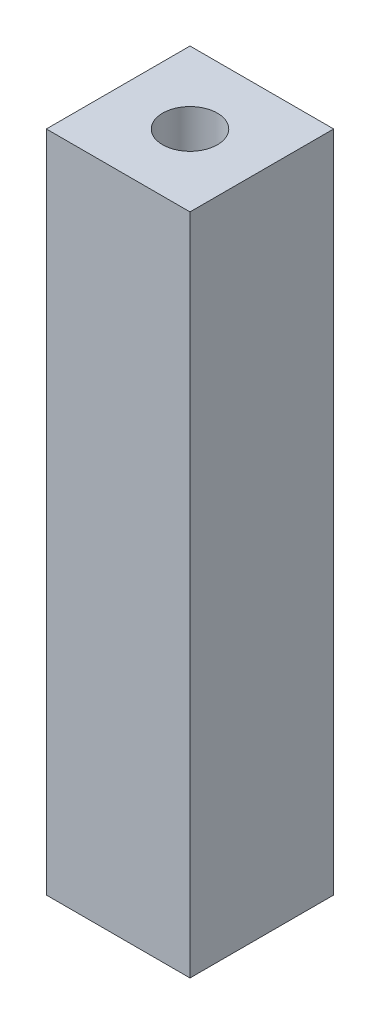
from build123d import *

# Parameters (mm, degrees)
SKETCH1_W             = 11
SKETCH1_H             = 11
BOSS_EXTRUDE1_DEPTH   = 50.8
M5X0_8_TAPPED_HOLE1_D = 4.2


with BuildPart() as part:
    # Sketch1 → Boss-Extrude1 (new body)
    with BuildSketch(Plane(origin=(0, 0, 0), x_dir=(1, 0, 0), z_dir=(0, 1, 0))):
        Rectangle(SKETCH1_W, SKETCH1_H)
    extrude(amount=BOSS_EXTRUDE1_DEPTH)

    # M5x0.8 Tapped Hole1 (through all)
    with Locations(Plane(origin=(0, 50.8, 0), x_dir=(1, 0, 0), z_dir=(0, 1, 0))):
        with Locations((0, 0)):
            Hole(M5X0_8_TAPPED_HOLE1_D / 2)


solid = part.part
